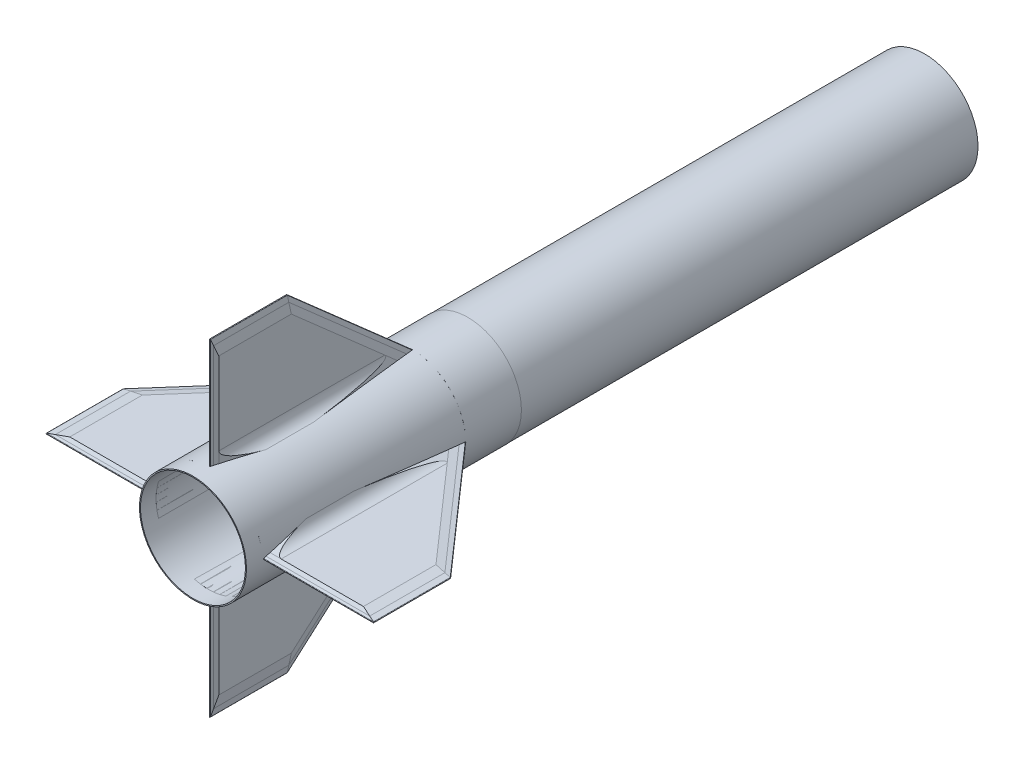
from build123d import *

# Parameters (mm, degrees)
FINBODY_DEPTH            = 3.175
CARBONFIBERX5_DEPTH      = 1.6002
CUT_EXTRUDE1_START       = 30.070082039
CUT_EXTRUDE1_OUTLINE_W   = 172
CUT_EXTRUDE1_OUTLINE_H   = 223
CUT_EXTRUDE1_DEPTH       = 3.929917961
CUT_EXTRUDE1_START_2     = 33.205646313
CUT_EXTRUDE1_2_OUTLINE_W = 172
CUT_EXTRUDE1_2_OUTLINE_H = 222
CUT_EXTRUDE1_2_DEPTH     = 3.794353687
CUT_EXTRUDE1_START_3     = -230
CUT_EXTRUDE1_3_DEPTH     = 340.7476603
CUT_EXTRUDE4_DEPTH       = 344.136185034
CUT_EXTRUDE4_DEPTH_BACK  = 344.136185034
CUT_EXTRUDE5_DEPTH       = 341.511591872
CUT_EXTRUDE5_DEPTH_BACK  = 341.511591872
SKETCH13_R               = 78.36
SKETCH13_R_2             = 77.09
BOSS_EXTRUDE1_DEPTH      = 914.4
BOSS_EXTRUDE2_REACH      = 934.109
BOSS_EXTRUDE3_START      = -56.951017769
BOSS_EXTRUDE3_DEPTH      = 70.189177625
BOSS_EXTRUDE3_START_2    = -274.544770627
BOSS_EXTRUDE3_2_DEPTH    = 262.648112268
BOSS_EXTRUDE3_START_3    = -88
BOSS_EXTRUDE3_3_DEPTH    = 101
CIRPATTERN1_COUNT        = 4
SKETCH18_W               = 519.548726742
SKETCH18_H               = 439.659397243
CUT_EXTRUDE6_DEPTH       = 615.0399
SKETCH17_R               = 78.614
SKETCH17_R_2             = 78.36
SKETCH17_R_3             = 77.09
BOSS_EXTRUDE4_DEPTH      = 0.1
SKETCH19_R               = 78.614
SKETCH19_R_2             = 77.09
BOSS_EXTRUDE5_DEPTH      = 0.1
SKETCH20_R               = 78.36
SKETCH20_R_2             = 77.09
BOSS_EXTRUDE6_DEPTH      = 914.4
SKETCH21_W               = 490.676006992
SKETCH21_H               = 455.150743556
CUT_EXTRUDE7_DEPTH       = 263.4
SKETCH22_R               = 78.36
SKETCH22_R_2             = 77.09
BOSS_EXTRUDE7_DEPTH      = 101.6
BOSS_EXTRUDE9_DEPTH      = 22.86
BOSS_EXTRUDE9_DEPTH_BACK = 381
SKETCH25_R               = 78.614
SKETCH25_R_2             = 77.09
BOSS_EXTRUDE10_DEPTH     = 481.120199
CIRPATTERN5_COUNT        = 2
CIRPATTERN5_ANGLE        = 90


with BuildPart() as part:
    # Sketch1 → FinBody (new body)
    with BuildSketch(Plane(origin=(0, 0, 0), x_dir=(1, 0, 0), z_dir=(0, 1, 0))):
        Polygon((0, 0), (0, 304.8), (167.64, 114.3), (167.64, 0), align=None)
    extrude(amount=FINBODY_DEPTH)

    # Cut-Extrude1 3 outline → Cut-Extrude1 3 (cut)
    with BuildSketch(Plane(origin=(0, 0, 0), x_dir=(0.7507135169227551, 0, -0.660627894892025), z_dir=(0.660627894892025, 0, 0.7507135169227549)).offset(CUT_EXTRUDE1_START_3)):
        with BuildLine():
            Line((191.381223248, 3.175), (197.389983277, 2.219021404))
            add(Edge.make_bspline(
                [(197.389983277, 2.219021404), (197.765632434, 2.159256568), (197.765632434, 1.5875), (197.765632434, 1.015743432), (197.389983277, 0.955978596)],
                knots=[1.675516082, 1.675516082, 1.675516082, 3.141592654, 3.141592654, 4.607669225, 4.607669225, 4.607669225], degree=2, weights=[1, 0.743144825, 1, 0.743144825, 1]))
            Line((197.389983277, 0.955978596), (191.381223248, 0))
            Line((191.381223248, 0), (201.359382363, 0))
            Line((201.359382363, 0), (201.359382363, 3.175))
            Line((201.359382363, 3.175), (191.381223248, 3.175))
        make_face()
    extrude(amount=CUT_EXTRUDE1_3_DEPTH, mode=Mode.SUBTRACT)


with BuildPart() as body_2:
    # Sketch2 → CarbonFiberx5 (new body)
    with BuildSketch(Plane(origin=(0, 3.175, 0), x_dir=(1, 0, 0), z_dir=(0, 1, 0))):
        Polygon((0, 0), (167.64, 0), (167.64, 114.3), (0, 304.8), align=None)
    extrude(amount=CARBONFIBERX5_DEPTH)


with BuildPart() as body_3:
    # Mirror2: mirrored copy
    add(body_2.part.mirror(Plane.ZX.offset(1.5875)))

    # Cut-Extrude1: read off the stored shape, not the designer's step
    # Cut-Extrude1 outline → Cut-Extrude1 (cut)
    with BuildSketch(Plane(origin=(0, 0, 0), x_dir=(0.9930191618244789, 0.11730698463031215, 0.012329460910890686), z_dir=(0.11795314429640895, -0.9875792989546955, -0.10379876698083995)).offset(CUT_EXTRUDE1_START)):
        with Locations((81, -193.5)):
            Rectangle(CUT_EXTRUDE1_OUTLINE_W, CUT_EXTRUDE1_OUTLINE_H)
    extrude(amount=CUT_EXTRUDE1_DEPTH, mode=Mode.SUBTRACT)


with BuildPart() as body_2_1:
    add(body_2.part)

    # Cut-Extrude1 2 outline → Cut-Extrude1 2 (cut)
    with BuildSketch(Plane(origin=(0, 0, 0), x_dir=(0.9930191618244789, -0.11730698463031215, 0.012329460910890686), z_dir=(0.11795314429640895, 0.9875792989546955, -0.10379876698083995)).offset(CUT_EXTRUDE1_START_2)):
        with Locations((80, 193)):
            Rectangle(CUT_EXTRUDE1_2_OUTLINE_W, CUT_EXTRUDE1_2_OUTLINE_H)
    extrude(amount=CUT_EXTRUDE1_2_DEPTH, mode=Mode.SUBTRACT)


with BuildPart() as cut_extrude4_tool:
    # Sketch11 → Cut-Extrude4 (new, two sides: drawn at the far end of the back side and taken through both)
    with BuildSketch(Plane.XY.offset(-CUT_EXTRUDE4_DEPTH_BACK)):
        with BuildLine():
            Line((152.535946429, 3.175), (161.631475206, 2.219021404))
            ThreePointArc((161.631475206, 2.219021404), (162.200099632, 1.5875), (161.631475206, 0.955978596))
            Line((161.631475206, 0.955978596), (152.535946429, 0))
            Line((152.535946429, 0), (167.64, 0))
            Line((167.64, 0), (167.64, 3.175))
            Line((167.64, 3.175), (152.535946429, 3.175))
        make_face()
        Polygon((137.311060429, 4.7752), (152.535946429, 3.175), (167.64, 3.175), (167.64, 4.7752), align=None)
        Polygon((167.64, 0), (152.535946429, 0), (137.311060429, -1.6002), (167.64, -1.6002), align=None)
    extrude(amount=CUT_EXTRUDE4_DEPTH + CUT_EXTRUDE4_DEPTH_BACK)


with BuildPart() as part_1:
    add(part.part)

    # Cut-Extrude4: cut by cut_extrude4_tool
    add(cut_extrude4_tool.part, mode=Mode.SUBTRACT)


with BuildPart() as body_2_2:
    add(body_2_1.part)

    # Cut-Extrude4: cut by cut_extrude4_tool
    add(cut_extrude4_tool.part, mode=Mode.SUBTRACT)


with BuildPart() as body_3_1:
    add(body_3.part)

    # Cut-Extrude4: cut by cut_extrude4_tool
    add(cut_extrude4_tool.part, mode=Mode.SUBTRACT)


with BuildPart() as cut_extrude5_tool:
    # Sketch12 → Cut-Extrude5 (new, two sides: drawn at the far end of the back side and taken through both)
    with BuildSketch(Plane.ZY.offset(-CUT_EXTRUDE5_DEPTH_BACK)):
        with BuildLine():
            Line((-5.924630657, 3.175), (-2.289101505, 2.2008629))
            ThreePointArc((-2.289101505, 2.2008629), (-1.818451599, 1.5875), (-2.289101505, 0.9741371))
            Line((-2.289101505, 0.9741371), (-5.924630657, 0))
            Line((-5.924630657, 0), (0, 0))
            Line((0, 0), (0, 3.175))
            Line((0, 3.175), (-5.924630657, 3.175))
        make_face()
        Polygon((-11.896658359, 4.7752), (-5.924630657, 3.175), (0, 3.175), (0, 4.7752), align=None)
        Polygon((0, 0), (-5.924630657, 0), (-11.896658359, -1.6002), (0, -1.6002), align=None)
    extrude(amount=CUT_EXTRUDE5_DEPTH + CUT_EXTRUDE5_DEPTH_BACK)


with BuildPart() as part_2:
    add(part_1.part)

    # Cut-Extrude5: cut by cut_extrude5_tool
    add(cut_extrude5_tool.part, mode=Mode.SUBTRACT)



with BuildPart() as body_2_3:
    add(body_2_2.part)

    # Cut-Extrude5: cut by cut_extrude5_tool
    add(cut_extrude5_tool.part, mode=Mode.SUBTRACT)


with BuildPart() as body_3_2:
    add(body_3_1.part)

    # Cut-Extrude5: cut by cut_extrude5_tool
    add(cut_extrude5_tool.part, mode=Mode.SUBTRACT)


with BuildPart() as body_4:
    # Sketch13 → Boss-Extrude1 (new body)
    with BuildSketch(Plane.XY):
        with Locations((-78.36, 1.5875)):
            Circle(SKETCH13_R)
        with Locations((-78.36, 1.5875)):
            Circle(SKETCH13_R_2, mode=Mode.SUBTRACT)
    extrude(amount=-BOSS_EXTRUDE1_DEPTH)


with BuildPart() as part_3:
    add(part_2.part)

    # Boss-Extrude2: up to this face of the body
    boss_extrude2_end = body_4.part.faces().sort_by_distance((-156.72, 1.5875, -457.2))[0]
    # Sketch14 → Boss-Extrude2 (add, up to the picked face)
    with BuildSketch(Plane.ZY, mode=Mode.PRIVATE) as boss_extrude2_sk1:
        with BuildLine():
            ThreePointArc((-2.289101505, 0.9741371), (-1.818451599, 1.5875), (-2.289101505, 2.2008629))
            Line((-2.289101505, 2.2008629), (-5.924630657, 3.175))
            Line((-5.924630657, 3.175), (-289.695946429, 3.175))
            Line((-289.695946429, 3.175), (-298.791475206, 2.219021404))
            ThreePointArc((-298.791475206, 2.219021404), (-299.360099632, 1.5875), (-298.791475206, 0.955978596))
            Line((-298.791475206, 0.955978596), (-289.695946429, 0))
            Line((-289.695946429, 0), (-5.924630657, 0))
            Line((-5.924630657, 0), (-2.289101505, 0.9741371))
        make_face()
    boss_extrude2_tool1 = split(extrude(boss_extrude2_sk1.sketch, amount=BOSS_EXTRUDE2_REACH, mode=Mode.PRIVATE), bisect_by=boss_extrude2_end, keep=Keep.BOTH, mode=Mode.PRIVATE)
    # Sketch14 → Boss-Extrude2 (add, up to the picked face)
    with BuildSketch(Plane.ZY, mode=Mode.PRIVATE) as boss_extrude2_sk2:
        Polygon((-289.695946429, 3.175), (-5.924630657, 3.175), (-11.896658359, 4.7752), (-274.471060429, 4.7752), align=None)
    boss_extrude2_tool2 = split(extrude(boss_extrude2_sk2.sketch, amount=BOSS_EXTRUDE2_REACH, mode=Mode.PRIVATE), bisect_by=boss_extrude2_end, keep=Keep.BOTH, mode=Mode.PRIVATE)
    # Sketch14 → Boss-Extrude2 (add, up to the picked face)
    with BuildSketch(Plane.ZY, mode=Mode.PRIVATE) as boss_extrude2_sk3:
        Polygon((-11.896658359, -1.6002), (-5.924630657, 0), (-289.695946429, 0), (-274.471060429, -1.6002), align=None)
    boss_extrude2_tool3 = split(extrude(boss_extrude2_sk3.sketch, amount=BOSS_EXTRUDE2_REACH, mode=Mode.PRIVATE), bisect_by=boss_extrude2_end, keep=Keep.BOTH, mode=Mode.PRIVATE)
    add(boss_extrude2_tool1.solids().sort_by(Axis((0, 1.5875, -149.762129), (-1, 0, 0)))[0])
    add(boss_extrude2_tool1.solids().sort_by(Axis((0, 1.5875, -149.762129), (-1, 0, 0)))[1])
    add(boss_extrude2_tool2.solids().sort_by(Axis((0, 3.964753, -145.52699), (-1, 0, 0)))[0])
    add(boss_extrude2_tool3.solids().sort_by(Axis((0, -0.789753, -145.52699), (-1, 0, 0)))[0])


with BuildPart() as body_5:
    # Boss-Extrude3: read off the stored shape, not the designer's step
    # Boss-Extrude3 outline → Boss-Extrude3 (new body)
    with BuildSketch(Plane.XY.offset(-80).offset(BOSS_EXTRUDE3_START)):
        with BuildLine():
            Line((-0.064864974, 4.7752), (16.477718228, 4.7752))
            ThreePointArc((16.477718228, 4.7752), (4.644384042, 8.896211353), (-2.069233135, 19.476281152))
            ThreePointArc((-2.069233135, 19.476281152), (-0.718318458, 12.173287045), (-0.064864974, 4.7752))
        make_face()
    extrude(amount=BOSS_EXTRUDE3_DEPTH)

    # Boss-Extrude3 2 outline → Boss-Extrude3 2 (add)
    with BuildSketch(Plane.XY.offset(BOSS_EXTRUDE3_START_2)):
        with BuildLine():
            Line((-0.064864974, 4.7752), (16.477718228, 4.7752))
            ThreePointArc((16.477718228, 4.7752), (4.644384042, 8.896211353), (-2.069233135, 19.476281152))
            ThreePointArc((-2.069233135, 19.476281152), (-0.718318458, 12.173287045), (-0.064864974, 4.7752))
        make_face()
    extrude(amount=BOSS_EXTRUDE3_2_DEPTH)

    # Boss-Extrude3 3 outline → Boss-Extrude3 3 (cut)
    with BuildSketch(Plane(origin=(0, 0, 0), x_dir=(0.07755232947375353, 0.9966790611369077, 0.024829121701067894), z_dir=(0.9492172233880417, -0.08143002573530268, 0.30390099330578807)).offset(BOSS_EXTRUDE3_START_3)):
        Polygon((4.458927845, -11.310361504), (17.593489909, -62.951705289), (20, -72.413415114), (20, -9), (3.871305906, -9), align=None)
        Polygon((20, -268), (20, -99.303590445), (-2.062394099, -261.451175711), (-2.953451108, -268), align=None)
    extrude(amount=BOSS_EXTRUDE3_3_DEPTH, mode=Mode.SUBTRACT)


with BuildPart() as body_6:
    # Mirror3: mirrored copy
    add(body_5.part.mirror(Plane.ZX.offset(1.5875)))


with BuildPart() as cirpattern1_1:
    # CirPattern1: pattern copy
    add(body_6.part.rotate(Axis((-78.36, 1.5875, -914.4), (0, 0, 1)), 1 * 360 / CIRPATTERN1_COUNT))


with BuildPart() as cirpattern1_2:
    # CirPattern1: pattern copy
    add(body_6.part.rotate(Axis((-78.36, 1.5875, -914.4), (0, 0, 1)), 2 * 360 / CIRPATTERN1_COUNT))


with BuildPart() as cirpattern1_3:
    # CirPattern1: pattern copy
    add(body_6.part.rotate(Axis((-78.36, 1.5875, -914.4), (0, 0, 1)), 3 * 360 / CIRPATTERN1_COUNT))


with BuildPart() as cirpattern1_4:
    # CirPattern1: pattern copy
    add(body_3_2.part.rotate(Axis((-78.36, 1.5875, -914.4), (0, 0, 1)), 1 * 360 / CIRPATTERN1_COUNT))


with BuildPart() as cirpattern1_5:
    # CirPattern1: pattern copy
    add(body_3_2.part.rotate(Axis((-78.36, 1.5875, -914.4), (0, 0, 1)), 2 * 360 / CIRPATTERN1_COUNT))


with BuildPart() as cirpattern1_6:
    # CirPattern1: pattern copy
    add(body_3_2.part.rotate(Axis((-78.36, 1.5875, -914.4), (0, 0, 1)), 3 * 360 / CIRPATTERN1_COUNT))


with BuildPart() as cirpattern1_7:
    # CirPattern1: pattern copy
    add(part_3.part.rotate(Axis((-78.36, 1.5875, -914.4), (0, 0, 1)), 1 * 360 / CIRPATTERN1_COUNT))


with BuildPart() as cirpattern1_8:
    # CirPattern1: pattern copy
    add(part_3.part.rotate(Axis((-78.36, 1.5875, -914.4), (0, 0, 1)), 2 * 360 / CIRPATTERN1_COUNT))


with BuildPart() as cirpattern1_9:
    # CirPattern1: pattern copy
    add(part_3.part.rotate(Axis((-78.36, 1.5875, -914.4), (0, 0, 1)), 3 * 360 / CIRPATTERN1_COUNT))


with BuildPart() as cirpattern1_10:
    # CirPattern1: pattern copy
    add(body_2_3.part.rotate(Axis((-78.36, 1.5875, -914.4), (0, 0, 1)), 1 * 360 / CIRPATTERN1_COUNT))


with BuildPart() as cirpattern1_11:
    # CirPattern1: pattern copy
    add(body_2_3.part.rotate(Axis((-78.36, 1.5875, -914.4), (0, 0, 1)), 2 * 360 / CIRPATTERN1_COUNT))


with BuildPart() as cirpattern1_12:
    # CirPattern1: pattern copy
    add(body_2_3.part.rotate(Axis((-78.36, 1.5875, -914.4), (0, 0, 1)), 3 * 360 / CIRPATTERN1_COUNT))


with BuildPart() as cirpattern1_13:
    # CirPattern1: pattern copy
    add(body_5.part.rotate(Axis((-78.36, 1.5875, -914.4), (0, 0, 1)), 1 * 360 / CIRPATTERN1_COUNT))


with BuildPart() as cirpattern1_14:
    # CirPattern1: pattern copy
    add(body_5.part.rotate(Axis((-78.36, 1.5875, -914.4), (0, 0, 1)), 2 * 360 / CIRPATTERN1_COUNT))


with BuildPart() as cirpattern1_15:
    # CirPattern1: pattern copy
    add(body_5.part.rotate(Axis((-78.36, 1.5875, -914.4), (0, 0, 1)), 3 * 360 / CIRPATTERN1_COUNT))


with BuildPart() as body_4_1:
    add(body_4.part)

    # Sketch18 → Cut-Extrude6 (cut)
    with BuildSketch(Plane(origin=(0, 0, -914.4), x_dir=(-1, 0, 0), z_dir=(0, 0, -1))):
        with Locations((83.18552997, 2.793882493)):
            Rectangle(SKETCH18_W, SKETCH18_H)
    extrude(amount=-CUT_EXTRUDE6_DEPTH, mode=Mode.SUBTRACT)

    # Sketch17 → Boss-Extrude4 (add)
    # profile 1 of 2: a face of its own
    with BuildSketch(Plane.XY):
        with Locations((-78.36, 1.5875)):
            Circle(SKETCH17_R)
        with Locations((-78.36, 1.5875)):
            Circle(SKETCH17_R_2, mode=Mode.SUBTRACT)
    # profile 2 of 2: a face of its own
    with BuildSketch(Plane.XY):
        with Locations((-78.36, 1.5875)):
            Circle(SKETCH17_R_2)
        with Locations((-78.36, 1.5875)):
            Circle(SKETCH17_R_3, mode=Mode.SUBTRACT)
    extrude(amount=-BOSS_EXTRUDE4_DEPTH)

    # Sketch19 → Boss-Extrude5 (add)
    with BuildSketch(Plane(origin=(0, 0, -299.360099632), x_dir=(-1, 0, 0), z_dir=(0, 0, -1))):
        with Locations(Location((78.36, 1.5875, 0), (0, 0, 180))):
            Circle(SKETCH19_R)
        with Locations(Location((78.36, 1.5875, 0), (0, 0, 180))):
            Circle(SKETCH19_R_2, mode=Mode.SUBTRACT)
    extrude(amount=-BOSS_EXTRUDE5_DEPTH)

    # Sketch20 → Boss-Extrude6 (add)
    with BuildSketch(Plane(origin=(0, 0, -299.360099632), x_dir=(-1, 0, 0), z_dir=(0, 0, -1))):
        with Locations(Location((78.36, 1.5875, 0), (0, 0, 180))):
            Circle(SKETCH20_R)
        with Locations(Location((78.36, 1.5875, 0), (0, 0, 180))):
            Circle(SKETCH20_R_2, mode=Mode.SUBTRACT)
    extrude(amount=BOSS_EXTRUDE6_DEPTH)

    # Sketch21 → Cut-Extrude7 (cut)
    with BuildSketch(Plane(origin=(0, 0, -1213.760099632), x_dir=(-1, 0, 0), z_dir=(0, 0, -1))):
        with Locations((78.493553622, -8.429021645)):
            Rectangle(SKETCH21_W, SKETCH21_H)
    extrude(amount=-CUT_EXTRUDE7_DEPTH, mode=Mode.SUBTRACT)

    # Sketch22 → Boss-Extrude7 (add)
    with BuildSketch(Plane(origin=(0, 0, -950.360099632), x_dir=(-1, 0, 0), z_dir=(0, 0, -1))):
        with Locations(Location((78.36, 1.5875, 0), (0, 0, 180))):
            Circle(SKETCH22_R)
        with Locations(Location((78.36, 1.5875, 0), (0, 0, 180))):
            Circle(SKETCH22_R_2, mode=Mode.SUBTRACT)
    extrude(amount=BOSS_EXTRUDE7_DEPTH)


with BuildPart() as body_22:
    # Sketch25 → Boss-Extrude9 (new, two sides: drawn at the far end of the back side and taken through both)
    with BuildSketch(Plane.XY.offset(-BOSS_EXTRUDE9_DEPTH_BACK)):
        with Locations((-78.36, 1.5875)):
            Circle(SKETCH25_R)
        with Locations((-78.36, 1.5875)):
            Circle(SKETCH25_R_2, mode=Mode.SUBTRACT)
    extrude(amount=BOSS_EXTRUDE9_DEPTH + BOSS_EXTRUDE9_DEPTH_BACK)


with BuildPart() as body_23:
    # Sketch23 → Boss-Extrude10 (new, through all)
    with BuildSketch(Plane(origin=(162.200099632, 0, 0), x_dir=(0, 0, -1), z_dir=(1, 0, 0))):
        with BuildLine():
            Line((274.507915528, 4.7752), (136.951017769, 19.476281152))
            Line((136.951017769, 19.476281152), (66.761840144, 19.476281152))
            Line((66.761840144, 19.476281152), (11.896658359, 4.7752))
            Line((11.896658359, 4.7752), (5.924630657, 3.175))
            Line((5.924630657, 3.175), (2.356869964, 2.219021404))
            Line((2.356869964, 2.219021404), (2.289101505, 2.2008629))
            ThreePointArc((2.289101505, 2.2008629), (1.818451599, 1.5875), (2.289101505, 0.9741371))
            Line((2.289101505, 0.9741371), (2.356869964, 0.955978596))
            Line((2.356869964, 0.955978596), (5.924630657, 0))
            Line((5.924630657, 0), (11.896658359, -1.6002))
            Line((11.896658359, -1.6002), (66.761840144, -16.301281152))
            Line((66.761840144, -16.301281152), (136.951017769, -16.301281152))
            Line((136.951017769, -16.301281152), (274.507915528, -1.6002))
            Line((274.507915528, -1.6002), (289.695946429, 0))
            Line((289.695946429, 0), (298.791475206, 0.955978596))
            ThreePointArc((298.791475206, 0.955978596), (299.196996596, 1.162602065), (299.360099632, 1.5875))
            ThreePointArc((299.360099632, 1.5875), (299.196996596, 2.012397935), (298.791475206, 2.219021404))
            Line((298.791475206, 2.219021404), (289.695946429, 3.175))
            Line((289.695946429, 3.175), (274.507915528, 4.7752))
        make_face()
    extrude(amount=-BOSS_EXTRUDE10_DEPTH)


with BuildPart() as cirpattern5_1:
    # CirPattern5: pattern copy
    add(body_23.part.rotate(Axis((-78.36, 1.5875, 0), (0, 0, -1)), 1 * CIRPATTERN5_ANGLE / (CIRPATTERN5_COUNT - 1)))


with BuildPart() as body_22_1:
    add(body_22.part)

    # Combine1: cut CirPattern5_1, body 23
    add(cirpattern5_1.part, mode=Mode.SUBTRACT)
    add(body_23.part, mode=Mode.SUBTRACT)


solid = Compound([body_2_3.part, body_3_2.part, part_3.part, body_5.part, body_6.part, cirpattern1_1.part, cirpattern1_2.part, cirpattern1_3.part, cirpattern1_4.part, cirpattern1_5.part, cirpattern1_6.part, cirpattern1_7.part, cirpattern1_8.part, cirpattern1_9.part, cirpattern1_10.part, cirpattern1_11.part, cirpattern1_12.part, cirpattern1_13.part, cirpattern1_14.part, cirpattern1_15.part, body_4_1.part, body_22_1.part])
